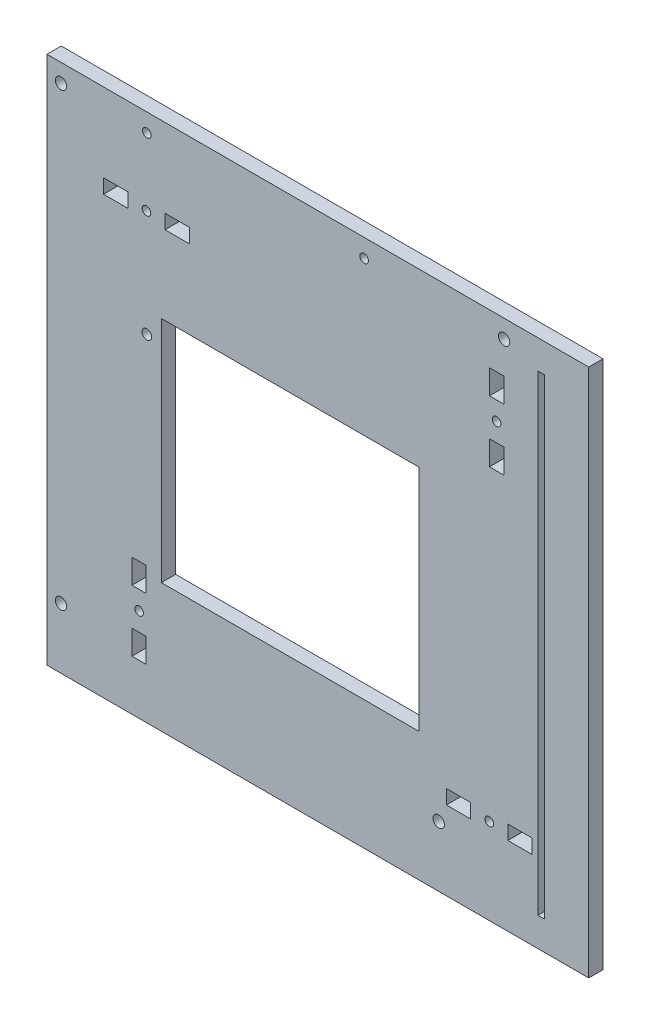
from build123d import *

# Parameters (mm, degrees)
SKETCH2_W           = 189.43
SKETCH2_H           = 185
SKETCH2_R           = 1.98
SKETCH2_R_2         = 1.5
SKETCH2_R_3         = 1.694817964
SKETCH2_W_2         = 2.32
SKETCH2_H_2         = 164.83
SKETCH2_W_3         = 8.5
SKETCH2_H_3         = 5
SKETCH2_W_4         = 90
SKETCH2_H_4         = 80
SKETCH2_W_5         = 5
SKETCH2_H_5         = 8.5
BOSS_EXTRUDE1_DEPTH = 5


with BuildPart() as part:
    # Sketch2 → Boss-Extrude1 (new body)
    with BuildSketch(Plane.XY):
        with Locations((9.715, -7.5)):
            Rectangle(SKETCH2_W, SKETCH2_H)
        with Locations((-80.1, 78.65)):
            Circle(SKETCH2_R, mode=Mode.SUBTRACT)
        with Locations((74.84, 78.65)):
            Circle(SKETCH2_R, mode=Mode.SUBTRACT)
        with Locations((51.98, -78.83)):
            Circle(SKETCH2_R, mode=Mode.SUBTRACT)
        with Locations((-80.1, -78.83)):
            Circle(SKETCH2_R, mode=Mode.SUBTRACT)
        with Locations((25.9, 78.65)):
            Circle(SKETCH2_R_2, mode=Mode.SUBTRACT)
        with Locations((-50.1, 78.65)):
            Circle(SKETCH2_R_2, mode=Mode.SUBTRACT)
        with Locations((-50.1, 17.65)):
            Circle(SKETCH2_R_3, mode=Mode.SUBTRACT)
        with Locations((-50.210927607, 55)):
            Circle(SKETCH2_R_2, mode=Mode.SUBTRACT)
        with Locations((72.215, 52.425927607)):
            Circle(SKETCH2_R_2, mode=Mode.SUBTRACT)
        with Locations((69.640927607, -70)):
            Circle(SKETCH2_R_2, mode=Mode.SUBTRACT)
        with Locations((-52.785, -67.425927607)):
            Circle(SKETCH2_R_2, mode=Mode.SUBTRACT)
        with Locations((87.77, -7.5)):
            Rectangle(SKETCH2_W_2, SKETCH2_H_2, mode=Mode.SUBTRACT)
        with Locations((-60.960927607, 55)):
            Rectangle(SKETCH2_W_3, SKETCH2_H_3, mode=Mode.SUBTRACT)
        with Locations((0, -15)):
            Rectangle(SKETCH2_W_4, SKETCH2_H_4, mode=Mode.SUBTRACT)
        with Locations((-39.460927607, 55)):
            Rectangle(SKETCH2_W_3, SKETCH2_H_3, mode=Mode.SUBTRACT)
        with Locations((72.215, 63.175927607)):
            Rectangle(SKETCH2_W_5, SKETCH2_H_5, mode=Mode.SUBTRACT)
        with Locations((72.215, 41.675927607)):
            Rectangle(SKETCH2_W_5, SKETCH2_H_5, mode=Mode.SUBTRACT)
        with Locations((80.390927607, -70)):
            Rectangle(SKETCH2_W_3, SKETCH2_H_3, mode=Mode.SUBTRACT)
        with Locations((58.890927607, -70)):
            Rectangle(SKETCH2_W_3, SKETCH2_H_3, mode=Mode.SUBTRACT)
        with Locations((-52.785, -78.175927607)):
            Rectangle(SKETCH2_W_5, SKETCH2_H_5, mode=Mode.SUBTRACT)
        with Locations((-52.785, -56.675927607)):
            Rectangle(SKETCH2_W_5, SKETCH2_H_5, mode=Mode.SUBTRACT)
    extrude(amount=BOSS_EXTRUDE1_DEPTH)


solid = part.part
